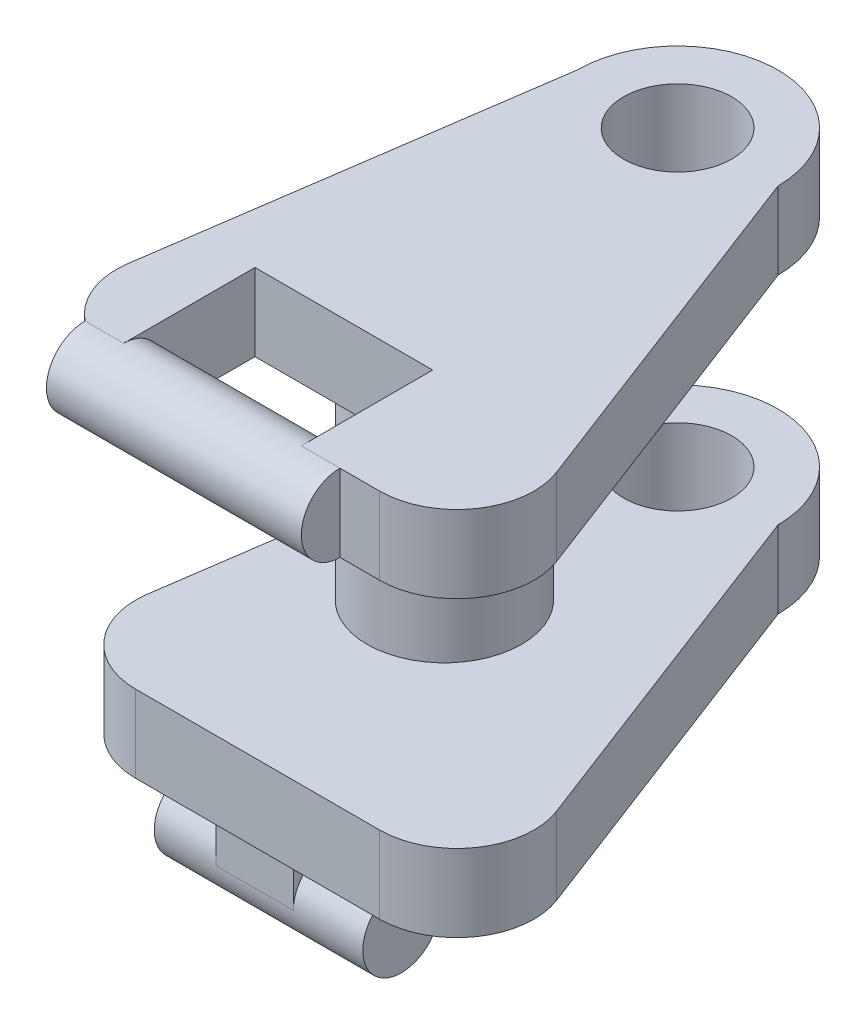
from build123d import *

# Parameters (mm, degrees)
SKETCH1_R                = 13
SKETCH1_R_2              = 7
BOSS_EXTRUDE2_DEPTH      = 10
SKETCH2_R                = 10
BOSS_EXTRUDE3_DEPTH      = 28
SKETCH3_R                = 10
SKETCH3_R_2              = 13
SKETCH3_R_3              = 7
BOSS_EXTRUDE4_DEPTH      = 10
SKETCH4_R                = 10
BOSS_EXTRUDE5_DEPTH      = 10
FILLET1_R                = 10
CUT_EXTRUDE1_DEPTH       = 17
BOSS_EXTRUDE6_DEPTH      = 28
BOSS_EXTRUDE6_DEPTH_BACK = 5
SKETCH6_R                = 5
FILLET2_R                = 10
SKETCH7_W                = 10
SKETCH7_H                = 10
BOSS_EXTRUDE7_DEPTH      = 10
BOSS_EXTRUDE8_DEPTH      = 9
BOSS_EXTRUDE8_DEPTH_BACK = 18
SKETCH8_R                = 5


with BuildPart() as part:
    # Sketch1 → Boss-Extrude2 (new body)
    # profile 1 of 2: a face of its own
    with BuildSketch(Plane(origin=(0, 0, 0), x_dir=(1, 0, 0), z_dir=(0, 1, 0))):
        with BuildLine():
            ThreePointArc((29.247640438, 60), (16.247640438, 47), (3.247640438, 60))
            Line((3.247640438, 60), (-5.462946679, 0))
            Line((-5.462946679, 0), (52.203983694, 0))
            Line((52.203983694, 0), (29.247640438, 60))
        make_face()
    # profile 2 of 2: a face of its own
    with BuildSketch(Plane(origin=(0, 0, 0), x_dir=(1, 0, 0), z_dir=(0, 1, 0))):
        with Locations((16.247640438, 60)):
            Circle(SKETCH1_R)
        with Locations(Location((16.247640438, 60, 0), (0, 0, 270))):
            Circle(SKETCH1_R_2, mode=Mode.SUBTRACT)
    extrude(amount=BOSS_EXTRUDE2_DEPTH)

    # Sketch2 → Boss-Extrude3 (add)
    with BuildSketch(Plane.XZ):
        with Locations(Location((16.05250876, -30, 0), (0, 0, 90))):
            Circle(SKETCH2_R)
    extrude(amount=BOSS_EXTRUDE3_DEPTH)



with BuildPart() as body_2:
    # Sketch3 → Boss-Extrude4 (new body)
    # profile 1 of 2: a face of its own
    with BuildSketch(Plane.XZ.offset(28)):
        with BuildLine():
            Line((-5.462946679, 0), (3.247640438, -60))
            ThreePointArc((3.247640438, -60), (16.247640438, -47), (29.247640438, -60))
            Line((29.247640438, -60), (52.203983694, 0))
            Line((52.203983694, 0), (-5.462946679, 0))
        make_face()
        with Locations(Location((16.05250876, -30, 0), (0, 0, 90))):
            Circle(SKETCH3_R, mode=Mode.SUBTRACT)
    # profile 2 of 2: a face of its own
    with BuildSketch(Plane.XZ.offset(28)):
        with Locations((16.247640438, -60)):
            Circle(SKETCH3_R_2)
        with Locations(Location((16.247640438, -60, 0), (0, 0, 90))):
            Circle(SKETCH3_R_3, mode=Mode.SUBTRACT)
    extrude(amount=BOSS_EXTRUDE4_DEPTH)


with BuildPart() as part_1:
    add(part.part)

    add(body_2.part)  # Boss-Extrude5 merges body 2
    # Sketch4 → Boss-Extrude5 (add)
    with BuildSketch(Plane.XZ.offset(28)):
        with Locations(Location((16.05250876, -30, 0), (0, 0, 90))):
            Circle(SKETCH4_R)
    extrude(amount=BOSS_EXTRUDE5_DEPTH)

    # Fillet1
    fillet1_edges = [part_1.edges().sort_by_distance(p)[0] for p in [
        (-5.462946679, -33, 0),
        (52.203983694, -33, 0),
    ]]
    fillet(fillet1_edges, radius=FILLET1_R)

    # Sketch5 → Cut-Extrude1 (cut)
    with BuildSketch(Plane.XY):
        Polygon((27.537053321, 10), (4.537053321, 10), (4.537053321, 5), (4.537053321, 0), (27.537053321, 0), align=None)
    extrude(amount=-CUT_EXTRUDE1_DEPTH, mode=Mode.SUBTRACT)

    # Sketch6 → Boss-Extrude6 (add, two sides: drawn at the far end of the back side and taken through both)
    with BuildSketch(Plane.ZY.offset(-27.537053321).offset(-BOSS_EXTRUDE6_DEPTH_BACK)):
        with Locations(Location((0, 5, 0), (0, 0, 90))):
            Circle(SKETCH6_R)
    extrude(amount=BOSS_EXTRUDE6_DEPTH + BOSS_EXTRUDE6_DEPTH_BACK)

    # Fillet2
    # the kernel refuses this fillet: 10 mm, written as the material it takes off along each edge
    with BuildSketch(Plane(origin=(52.203983694, -36.33251049, 0), x_dir=(-0.3573434345280911, 0, -0.9339730562493053), z_dir=(0, 1, 0))) as fillet2_piece_1:
        with BuildLine():
            CenterArc((FILLET2_R * 1.45330041958, FILLET2_R), FILLET2_R, 159.0628634, 110.9371366)
            Line((FILLET2_R * 0.519327363336, FILLET2_R * 1.35734343453), (FILLET2_R * 0.500647902211, FILLET2_R * 1.36449030322))
            Line((FILLET2_R * 0.500647902211, FILLET2_R * 1.36449030322), (-FILLET2_R * 0.0290660083917, -FILLET2_R * 0.02))
            Line((-FILLET2_R * 0.0290660083917, -FILLET2_R * 0.02), (FILLET2_R * 1.45330041958, -FILLET2_R * 0.02))
            Line((FILLET2_R * 1.45330041958, -FILLET2_R * 0.02), (FILLET2_R * 1.45330041958, 0))
        make_face()
    extrude(amount=82.665020979, mode=Mode.SUBTRACT)
    with BuildSketch(Plane(origin=(-5.462946679, -23.371123881, 0), x_dir=(1, 0, 0), z_dir=(0, 1, 0))) as fillet2_piece_2:
        with BuildLine():
            CenterArc((11.239350904, 7.814761692), FILLET2_R, 171.739711253, 59.656220213)
            Line((1.343094868, 9.251465031), (1.145169748, 9.280199097))
            Line((1.145169748, 9.280199097), (-0.197925121, 0.028734067))
            Line((-0.197925121, 0.028734067), (0, -0.2))
            ThreePointArc((0, -0.2), (2.5, -0.2), (4.875212982, -0.156295234))
            Line((4.875212982, -0.156295234), (5, 0))
        make_face()
    extrude(amount=56.742247763, mode=Mode.SUBTRACT)

    # Sketch7 → Boss-Extrude7 (add)
    with BuildSketch(Plane(origin=(0, -38, 0), x_dir=(-1, 0, 0), z_dir=(0, -1, 0))):
        with Locations((-16.093649369, 10.399188766)):
            Rectangle(SKETCH7_W, SKETCH7_H)
    extrude(amount=BOSS_EXTRUDE7_DEPTH)

    # Sketch8 → Boss-Extrude8 (add, two sides: drawn at the far end of the back side and taken through both)
    with BuildSketch(Plane(origin=(21.093649369, 0, 0), x_dir=(0, 0, -1), z_dir=(1, 0, 0)).offset(-BOSS_EXTRUDE8_DEPTH_BACK)):
        with Locations((10.399188766, -48)):
            Circle(SKETCH8_R)
    extrude(amount=BOSS_EXTRUDE8_DEPTH + BOSS_EXTRUDE8_DEPTH_BACK)


solid = part_1.part
